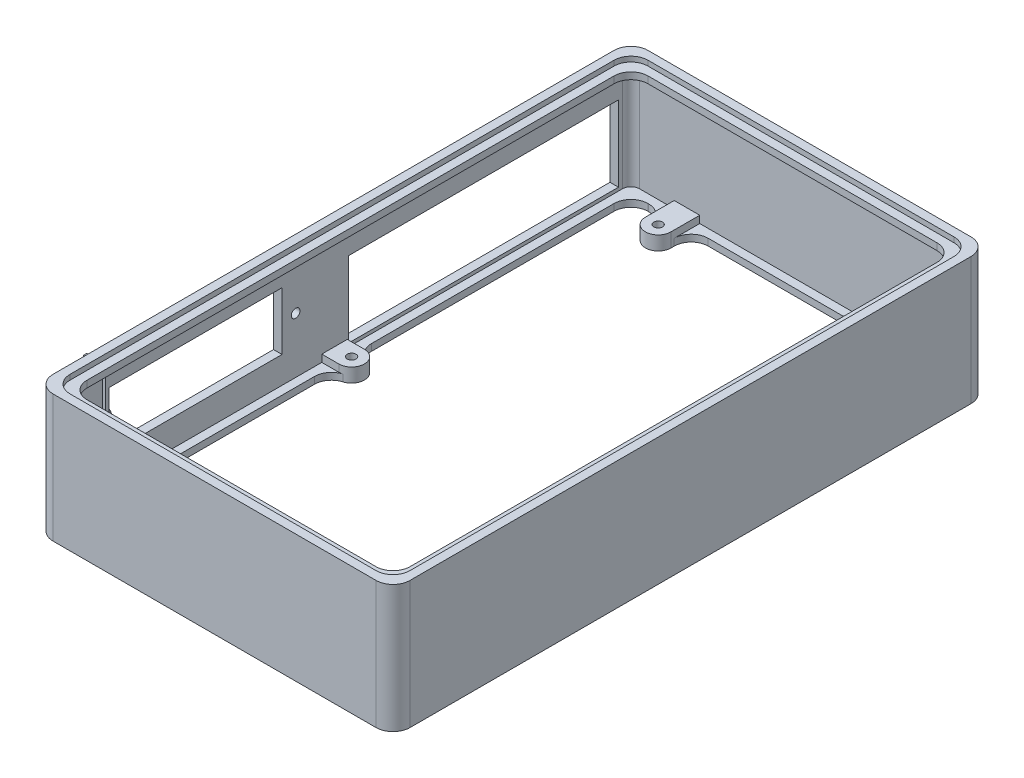
from build123d import *
from build123d.topology import SkipClean

# Parameters (mm, degrees)
SKETCH1_W            = 210
SKETCH1_H            = 350
SKETCH1_W_2          = 200
SKETCH1_H_2          = 340
BOSS_EXTRUDE2_DEPTH  = 75
SKETCH3_W            = 200
SKETCH3_H            = 22.93
SKETCH3_R            = 2.55
SKETCH3_H_2          = 12
BOSS_EXTRUDE3_DEPTH  = 6
SKETCH4_W            = 158.75
SKETCH4_H            = 44.5
CUT_EXTRUDE1_DEPTH   = 66
SKETCH5_W            = 101.8
SKETCH5_H            = 13
CUT_EXTRUDE2_DEPTH   = 66
SKETCH7_W            = 2
SKETCH7_H            = 53
BOSS_EXTRUDE4_DEPTH  = 8
SKETCH8_W            = 101.8
SKETCH8_H            = 8
CUT_EXTRUDE3_DEPTH   = 8
SKETCH9_R            = 2.55
CUT_EXTRUDE4_DEPTH   = 3
BOSS_EXTRUDE5_START  = 3
SKETCH11_R           = 4.5
SKETCH11_R_2         = 2.55
BOSS_EXTRUDE5_DEPTH  = 3
CHAMFER1_SIZE        = 3
SKETCH12_R           = 4
CUT_EXTRUDE5_DEPTH   = 46
SKETCH13_W           = 200
SKETCH13_H           = 340
SKETCH13_W_2         = 190
SKETCH13_H_2         = 330
BOSS_EXTRUDE6_DEPTH  = 4
SKETCH14_W           = 200
SKETCH14_H           = 340
SKETCH14_W_2         = 190
SKETCH14_H_2         = 330
BOSS_EXTRUDE7_DEPTH  = 4
FILLET1_R            = 10
FILLET2_R            = 5
FILLET3_R            = 10
FILLET4_R            = 10
CUT_EXTRUDE8_DEPTH   = 10
BOSS_EXTRUDE8_START  = -6
BOSS_EXTRUDE8_DEPTH  = 6
BOSS_EXTRUDE9_DEPTH  = 4
FILLET5_R            = 10
SKETCH23_W           = 158.75
SKETCH23_H           = 8.5
CUT_EXTRUDE9_DEPTH   = 10
SKETCH24_W           = 158.75
SKETCH24_H           = 8.5
BOSS_EXTRUDE10_DEPTH = 5
BOSS_EXTRUDE11_START = 2.23
BOSS_EXTRUDE11_DEPTH = 2.23
SKETCH27_R           = 2.55
CUT_EXTRUDE10_DEPTH  = 49.23
FILLET6_R            = 10


with BuildPart() as part:
    # Sketch1 → Boss-Extrude2 (new body)
    with BuildSketch(Plane(origin=(0, 0, 0), x_dir=(1, 0, 0), z_dir=(0, 1, 0))):
        with Locations((105, 175)):
            Rectangle(SKETCH1_W, SKETCH1_H)
        with Locations((105, 175)):
            Rectangle(SKETCH1_W_2, SKETCH1_H_2, mode=Mode.SUBTRACT)
    extrude(amount=BOSS_EXTRUDE2_DEPTH)

    # Sketch3 → Boss-Extrude3 (add)
    # profile 1 of 2: a face of its own
    with BuildSketch(Plane(origin=(0, 3, 0), x_dir=(-1, 0, 0), z_dir=(0, -1, 0))):
        with Locations((-105, 333.535)):
            Rectangle(SKETCH3_W, SKETCH3_H)
        with Locations(Location((-170, 328.07, 0), (0, 0, 90))):
            Circle(SKETCH3_R, mode=Mode.SUBTRACT)
        with Locations(Location((-37.92, 328.07, 0), (0, 0, 90))):
            Circle(SKETCH3_R, mode=Mode.SUBTRACT)
    # profile 2 of 2: a face of its own
    with BuildSketch(Plane(origin=(0, 3, 0), x_dir=(-1, 0, 0), z_dir=(0, -1, 0))):
        with Locations((-105, 170.59)):
            Rectangle(SKETCH3_W, SKETCH3_H_2)
        with Locations(Location((-170, 170.59, 0), (0, 0, 90))):
            Circle(SKETCH3_R, mode=Mode.SUBTRACT)
        with Locations(Location((-15.06, 170.59, 0), (0, 0, 90))):
            Circle(SKETCH3_R, mode=Mode.SUBTRACT)
    extrude(amount=-BOSS_EXTRUDE3_DEPTH)

    # Sketch4 → Cut-Extrude1 (cut)
    with BuildSketch(Plane(origin=(5, 0, 0), x_dir=(0, 0, -1), z_dir=(1, 0, 0))):
        with Locations((258.245, 39.75)):
            Rectangle(SKETCH4_W, SKETCH4_H)
    extrude(amount=-CUT_EXTRUDE1_DEPTH, mode=Mode.SUBTRACT)

    # Sketch5 → Cut-Extrude2 (cut)
    with BuildSketch(Plane.ZY):
        with BuildLine():
            ThreePointArc((-145.15, 39.75), (-147.7, 42.3), (-150.25, 39.75))
            Line((-150.25, 39.75), (-147.7, 39.75))
            Line((-147.7, 39.75), (-145.15, 39.75))
        make_face()
        with BuildLine():
            Line((-147.7, 39.75), (-150.25, 39.75))
            ThreePointArc((-150.25, 39.75), (-147.7, 37.2), (-145.15, 39.75))
            Line((-145.15, 39.75), (-147.7, 39.75))
        make_face()
        with Locations((-88.8, 29.25)):
            Rectangle(SKETCH5_W, SKETCH5_H)
        with Locations((-88.8, 50.25)):
            Rectangle(SKETCH5_W, SKETCH5_H)
        Polygon((-35.9, 39.75), (-35.9, 29.25), (-35.9, 14.75), (-34.15, 14.75), (-34.15, 67.75), (-35.9, 67.75), align=None)
    extrude(amount=-CUT_EXTRUDE2_DEPTH, mode=Mode.SUBTRACT)

    # Sketch7 → Boss-Extrude4 (add)
    with BuildSketch(Plane.ZY):
        with Locations((-36.9, 41.25)):
            Rectangle(SKETCH7_W, SKETCH7_H)
    extrude(amount=BOSS_EXTRUDE4_DEPTH)

    # Sketch8 → Cut-Extrude3 (cut)
    with BuildSketch(Plane.ZY):
        with Locations((-88.8, 39.75)):
            Rectangle(SKETCH8_W, SKETCH8_H)
    extrude(amount=-CUT_EXTRUDE3_DEPTH, mode=Mode.SUBTRACT)

    # Sketch9 → Cut-Extrude4 (cut)
    with BuildSketch(Plane(origin=(0, 0, -37.9), x_dir=(-1, 0, 0), z_dir=(0, 0, -1))):
        with Locations((0.5, 39.25)):
            Circle(SKETCH9_R)
    extrude(amount=-CUT_EXTRUDE4_DEPTH, mode=Mode.SUBTRACT)

    # Sketch11 → Boss-Extrude5 (add)
    with BuildSketch(Plane(origin=(0, 0, -37.9), x_dir=(-1, 0, 0), z_dir=(0, 0, -1)).offset(BOSS_EXTRUDE5_START)):
        with Locations(Location((0.5, 39.25, 0), (0, 0, 180))):
            Circle(SKETCH11_R)
        with Locations((0.5, 39.25)):
            Circle(SKETCH11_R_2, mode=Mode.SUBTRACT)
    extrude(amount=-BOSS_EXTRUDE5_DEPTH)

    # Chamfer1
    # the kernel refuses this chamfer: 3 mm, written as the material it adds along each edge
    with BuildSketch(Plane(origin=(-0.5, 39.25, -37.9), x_dir=(1, 0, 0), z_dir=(0, 1, 0))) as chamfer1_piece_1_section:
        Polygon((4.5 + CHAMFER1_SIZE, 0), (4.5, CHAMFER1_SIZE), (4.5, 0), align=None)
    chamfer1_piece_1 = revolve(axis=Axis((-0.5, 39.25, -37.9), (0, 0, -1)), mode=Mode.PRIVATE)
    chamfer1_piece_1 = split(chamfer1_piece_1, bisect_by=Plane(origin=(5, 39.25, -39.319322), z_dir=(-1, 0, 0)), keep=Keep.TOP, mode=Mode.PRIVATE)
    chamfer1_piece_1 = split(chamfer1_piece_1, bisect_by=Plane(origin=(-8, 39.25, -39.319322), z_dir=(1, 0, 0)), keep=Keep.TOP, mode=Mode.PRIVATE)
    chamfer1_piece_1 = split(chamfer1_piece_1, bisect_by=Plane(origin=(-6.504175, 39.25, -40.9), z_dir=(0, 0, 1)), keep=Keep.TOP, mode=Mode.PRIVATE)
    add(chamfer1_piece_1)

    # Sketch12 → Cut-Extrude5 (cut)
    with BuildSketch(Plane.XY.offset(-35.9)):
        with Locations((-0.5, 39.25)):
            Circle(SKETCH12_R)
    extrude(amount=CUT_EXTRUDE5_DEPTH, mode=Mode.SUBTRACT)

    # Sketch13 → Boss-Extrude6 (add)
    with BuildSketch(Plane(origin=(0, 72, 0), x_dir=(1, 0, 0), z_dir=(0, 1, 0))):
        with Locations((105, 175)):
            Rectangle(SKETCH13_W, SKETCH13_H)
        with Locations((105, 175)):
            Rectangle(SKETCH13_W_2, SKETCH13_H_2, mode=Mode.SUBTRACT)
    extrude(amount=-BOSS_EXTRUDE6_DEPTH)

    # Sketch14 → Boss-Extrude7 (add)
    with BuildSketch(Plane.XZ.offset(-3)):
        with Locations((105, -175)):
            Rectangle(SKETCH14_W, SKETCH14_H)
        with Locations((105, -175)):
            Rectangle(SKETCH14_W_2, SKETCH14_H_2, mode=Mode.SUBTRACT)
    extrude(amount=-BOSS_EXTRUDE7_DEPTH)

    # Fillet1
    fillet1_edges = [part.edges().sort_by_distance(p)[0] for p in [
        (5, 37.5, -5),
        (205, 37.5, -5),
        (205, 38.5, -345),
    ]]
    fillet(fillet1_edges, radius=FILLET1_R)
    fillet1_2_edges = [part.edges().sort_by_distance(p)[0] for p in [
        (210, 37.5, 0),
        (0, 17.640687, 0),
        (0, 37.5, -350),
        (210, 37.5, -350),
    ]]
    fillet(fillet1_2_edges, radius=FILLET1_R)

    # Fillet2
    fillet2_edges = [part.edges().sort_by_distance(p)[0] for p in [
        (5, 38.5, -345),
    ]]
    fillet(fillet2_edges, radius=FILLET2_R)

    # Fillet3
    fillet3_edges = [part.edges().sort_by_distance(p)[0] for p in [
        (5, 73.5, -5),
        (205, 73.5, -5),
        (205, 73.5, -345),
        (5, 73.5, -345),
        (200, 70, -10),
        (10, 70, -10),
        (10, 70, -340),
        (200, 70, -340),
    ]]
    fillet(fillet3_edges, radius=FILLET3_R)

    # Fillet4
    fillet4_edges = [part.edges().sort_by_distance(p)[0] for p in [
        (5, 1.5, -5),
        (205, 1.5, -5),
        (5, 1.5, -345),
        (205, 1.5, -345),
    ]]
    fillet(fillet4_edges, radius=FILLET4_R)

    # Sketch16 → Cut-Extrude8 (cut)
    with BuildSketch(Plane(origin=(0, 9, 0), x_dir=(1, 0, 0), z_dir=(0, 1, 0))):
        with BuildLine():
            Line((45.42, 345), (45.42, 328.07))
            ThreePointArc((45.42, 328.07), (44.628204, 324.715898), (42.42, 322.07))
            Line((42.42, 322.07), (165.5, 322.07))
            ThreePointArc((165.5, 322.07), (163.291796, 324.715898), (162.5, 328.07))
            Line((162.5, 328.07), (162.5, 345))
            Line((162.5, 345), (45.42, 345))
        make_face()
        with BuildLine():
            ThreePointArc((33.42, 322.07), (31.211796, 324.715898), (30.42, 328.07))
            Line((30.42, 328.07), (30.42, 345))
            Line((30.42, 345), (10, 345))
            ThreePointArc((10, 345), (6.464466, 343.535534), (5, 340))
            Line((5, 340), (5, 322.07))
            Line((5, 322.07), (33.42, 322.07))
        make_face()
        with BuildLine():
            ThreePointArc((165.5, 164.59), (162.5, 170.59), (165.5, 176.59))
            Line((165.5, 176.59), (19.56, 176.59))
            ThreePointArc((19.56, 176.59), (21.768204, 173.944102), (22.56, 170.59))
            ThreePointArc((22.56, 170.59), (21.768204, 167.235898), (19.56, 164.59))
            Line((19.56, 164.59), (165.5, 164.59))
        make_face()
    extrude(amount=-CUT_EXTRUDE8_DEPTH, mode=Mode.SUBTRACT)

    # Sketch19 → Boss-Extrude8 (add)
    with BuildSketch(Plane(origin=(0, 9, 0), x_dir=(1, 0, 0), z_dir=(0, 1, 0)).offset(BOSS_EXTRUDE8_START)):
        with BuildLine():
            Line((205, 322.07), (165.5, 322.07))
            ThreePointArc((165.5, 322.07), (167.628292, 320.954875), (170, 320.57))
            Line((170, 320.57), (205, 320.57))
            Line((205, 320.57), (205, 322.07))
        make_face()
        with BuildLine():
            ThreePointArc((165.5, 164.59), (167.628292, 163.474875), (170, 163.09))
            Line((170, 163.09), (205, 163.09))
            Line((205, 163.09), (205, 164.59))
            Line((205, 164.59), (165.5, 164.59))
        make_face()
        with BuildLine():
            ThreePointArc((170, 178.09), (167.628292, 177.705125), (165.5, 176.59))
            Line((165.5, 176.59), (205, 176.59))
            Line((205, 176.59), (205, 178.09))
            Line((205, 178.09), (170, 178.09))
        make_face()
        with BuildLine():
            ThreePointArc((19.56, 176.59), (17.431708, 177.705125), (15.06, 178.09))
            Line((15.06, 178.09), (5, 178.09))
            Line((5, 178.09), (5, 176.59))
            Line((5, 176.59), (19.56, 176.59))
        make_face()
        with BuildLine():
            Line((5, 163.09), (15.06, 163.09))
            ThreePointArc((15.06, 163.09), (17.431708, 163.474875), (19.56, 164.59))
            Line((19.56, 164.59), (5, 164.59))
            Line((5, 164.59), (5, 163.09))
        make_face()
        with BuildLine():
            ThreePointArc((33.42, 322.07), (37.92, 320.57), (42.42, 322.07))
            Line((42.42, 322.07), (33.42, 322.07))
        make_face()
    extrude(amount=BOSS_EXTRUDE8_DEPTH)

    # Sketch22 → Boss-Extrude9 (add)
    with BuildSketch(Plane.XZ.offset(-3)):
        with BuildLine():
            Line((10, -330), (10, -322.07))
            Line((10, -322.07), (5, -322.07))
            Line((5, -322.07), (5, -340))
            ThreePointArc((5, -340), (6.464466, -343.535534), (10, -345))
            Line((10, -345), (162.5, -345))
            Line((162.5, -345), (162.5, -340))
            Line((162.5, -340), (20, -340))
            ThreePointArc((20, -340), (12.928932, -337.071068), (10, -330))
        make_face()
    extrude(amount=-BOSS_EXTRUDE9_DEPTH)

    # Fillet5
    # the kernel refuses this fillet: 10 mm, written as the material it adds along each edge
    with BuildSketch(Plane(origin=(200, 3, -178.09), x_dir=(0, 0, -1), z_dir=(0, 1, 0)), Plane(origin=(45.42, 3, -340), x_dir=(0, 0, 1), z_dir=(0, 1, 0))) as fillet5_piece_1:
        with BuildLine():
            CenterArc((FILLET5_R, FILLET5_R), FILLET5_R, 180, 90)
            Line((0, FILLET5_R), (0, 0))
            Line((0, 0), (FILLET5_R, 0))
        make_face()
    extrude(amount=4)
    with BuildSketch(Plane(origin=(200, 7, -163.09), x_dir=(-1, 0, 0), z_dir=(0, -1, 0)), Plane(origin=(30.42, 7, -340), x_dir=(-1, 0, 0), z_dir=(0, -1, 0))) as fillet5_piece_2:
        with BuildLine():
            CenterArc((FILLET5_R, -FILLET5_R), FILLET5_R, 90, 90)
            Line((0, -FILLET5_R), (0, 0))
            Line((0, 0), (FILLET5_R, 0))
        make_face()
    extrude(amount=4)
    with BuildSketch(Plane(origin=(10, 7, -178.09), x_dir=(0, 0, -1), z_dir=(0, -1, 0)), Plane(origin=(10, 3, -163.09), x_dir=(0, 0, 1), z_dir=(0, 1, 0))) as fillet5_piece_3:
        with BuildLine():
            CenterArc((9.288282, 10), FILLET5_R, 196.396671, 73.603329)
            Line((-0.305022, 7.177143), (-1.264353, 6.894857))
            ThreePointArc((-1.264353, 6.894857), (-1, 5.06), (-1, 0))
            Line((-1, 0), (0, -1))
            Line((0, -1), (9.288282, -1))
            Line((9.288282, -1), (9.288282, 0))
        make_face()
    extrude(amount=4)

    # Sketch23 → Cut-Extrude9 (cut)
    with BuildSketch(Plane(origin=(5, 0, 0), x_dir=(0, 0, -1), z_dir=(1, 0, 0))):
        with Locations((258.245, 13.25)):
            Rectangle(SKETCH23_W, SKETCH23_H)
    extrude(amount=-CUT_EXTRUDE9_DEPTH, mode=Mode.SUBTRACT)

    # Sketch24 → Boss-Extrude10 (add)
    with BuildSketch(Plane(origin=(5, 0, 0), x_dir=(0, 0, -1), z_dir=(1, 0, 0))):
        with Locations((258.245, 57.75)):
            Rectangle(SKETCH24_W, SKETCH24_H)
    extrude(amount=-BOSS_EXTRUDE10_DEPTH)

    # Sketch25 → Boss-Extrude11 (add)
    with SkipClean():  # the faces are left unmerged after this step: merging them gives an invalid solid
        with BuildSketch(Plane(origin=(0, 9, 0), x_dir=(1, 0, 0), z_dir=(0, 1, 0)).offset(BOSS_EXTRUDE11_START)):
            with BuildLine():
                Line((15.06, 178.09), (5, 178.09))
                Line((5, 178.09), (5, 163.09))
                Line((5, 163.09), (15.06, 163.09))
                ThreePointArc((15.06, 163.09), (22.56, 170.59), (15.06, 178.09))
            make_face()
            with BuildLine():
                Line((170, 163.09), (205, 163.09))
                Line((205, 163.09), (205, 178.09))
                Line((205, 178.09), (170, 178.09))
                ThreePointArc((170, 178.09), (162.5, 170.59), (170, 163.09))
            make_face()
            with BuildLine():
                Line((170, 320.57), (205, 320.57))
                Line((205, 320.57), (205, 335))
                ThreePointArc((205, 335), (202.071068, 342.071068), (195, 345))
                Line((195, 345), (162.5, 345))
                Line((162.5, 345), (162.5, 328.07))
                ThreePointArc((162.5, 328.07), (164.696699, 322.766699), (170, 320.57))
            make_face()
            with BuildLine():
                Line((45.42, 345), (30.42, 345))
                Line((30.42, 345), (30.42, 328.07))
                ThreePointArc((30.42, 328.07), (37.92, 320.57), (45.42, 328.07))
                Line((45.42, 328.07), (45.42, 345))
            make_face()
        extrude(amount=-BOSS_EXTRUDE11_DEPTH)

    # Sketch27 → Cut-Extrude10 (cut)
    with SkipClean():  # the faces are left unmerged after this step: merging them gives an invalid solid
        with BuildSketch(Plane.XZ.offset(-3)):
            with Locations(Location((37.92, -328.07, 0), (0, 0, 270))):
                Circle(SKETCH27_R)
            with Locations(Location((170, -328.07, 0), (0, 0, 270))):
                Circle(SKETCH27_R)
            with Locations(Location((170, -170.59, 0), (0, 0, 270))):
                Circle(SKETCH27_R)
            with Locations(Location((15.06, -170.59, 0), (0, 0, 270))):
                Circle(SKETCH27_R)
        extrude(amount=-CUT_EXTRUDE10_DEPTH, mode=Mode.SUBTRACT)

    # Fillet6
    fillet6_edges = [part.edges().sort_by_distance(p)[0] for p in [
        (10, 5, -10),
        (200, 5, -10),
    ]]
    fillet(fillet6_edges, radius=FILLET6_R)


solid = part.part
